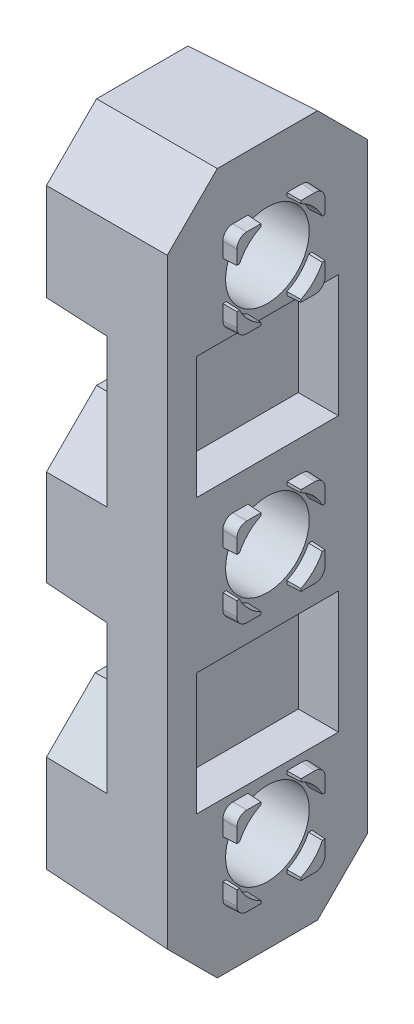
from build123d import *

# Parameters (mm, degrees)
SKETCH1_W                 = 9.716506228
SKETCH1_H                 = 35.116506228
BOSS_EXTRUDE1_DEPTH       = 6.35
CUT_EXTRUDE1_DEPTH        = 3.175
CUT_EXTRUDE2_DEPTH        = 3.175
CUT_EXTRUDE3_DEPTH        = 3.175
CUT_EXTRUDE4_DEPTH        = 3.175
BOSS_EXTRUDE2_DEPTH       = 0.6858
BOSS_EXTRUDE2_TAPER       = 2
BOSS_EXTRUDE3_DEPTH       = 0.6858
BOSS_EXTRUDE3_TAPER       = 2
BOSS_EXTRUDE4_DEPTH       = 0.6858
BOSS_EXTRUDE4_TAPER       = 2
BOSS_EXTRUDE5_DEPTH       = 0.6858
BOSS_EXTRUDE5_TAPER       = 2
BOSS_EXTRUDE6_DEPTH       = 0.6858
BOSS_EXTRUDE6_TAPER       = 2
BOSS_EXTRUDE7_DEPTH       = 0.6858
BOSS_EXTRUDE7_TAPER       = 2
BOSS_EXTRUDE8_DEPTH       = 0.6858
BOSS_EXTRUDE8_TAPER       = 2
BOSS_EXTRUDE9_DEPTH       = 0.6858
BOSS_EXTRUDE9_TAPER       = 2
BOSS_EXTRUDE10_DEPTH      = 0.6858
BOSS_EXTRUDE10_TAPER      = 2
BOSS_EXTRUDE11_DEPTH      = 0.6858
BOSS_EXTRUDE11_TAPER      = 2
BOSS_EXTRUDE12_DEPTH      = 0.6858
BOSS_EXTRUDE12_TAPER      = 2
BOSS_EXTRUDE13_DEPTH      = 0.6858
BOSS_EXTRUDE13_TAPER      = 2
SKETCH18_W                = 7.200000746
SKETCH18_H                = 6.200001039
CUT_EXTRUDE5_DEPTH        = 2.032
SKETCH19_W                = 7.200000746
SKETCH19_H                = 6.200000866
CUT_EXTRUDE6_DEPTH        = 2.032
DRAFT1_ANGLE              = 2.827279459
DRAFT2_ANGLE              = 2
F_6_CLEARANCE_HOLE1_D     = 4.2418
F_6_CLEARANCE_HOLE1_DEPTH = 7.0358
CHAMFER1_SIZE             = 2.536908263
CHAMFER1_PART_2_SIZE      = 2.536908263
FILLET1_R                 = 0.507999989


with BuildPart() as part:
    # Sketch1 → Boss-Extrude1 (new body)
    with BuildSketch(Plane(origin=(88.976200533, 0, 0), x_dir=(0, 0, -1), z_dir=(1, 0, 0))):
        with Locations((12.699999697, 26.416015382)):
            Rectangle(SKETCH1_W, SKETCH1_H)
    extrude(amount=-BOSS_EXTRUDE1_DEPTH)

    # Sketch2 → Cut-Extrude1 (cut)
    with BuildSketch(Plane.ZY.offset(-82.626200533)):
        Polygon((-7.841746583, 36.509270747), (-10.315251163, 34.035766168), (-11.699992639, 34.035766168), (-11.699992639, 31.385266496), (-10.380199322, 31.385266496), (-7.841746583, 28.846813757), align=None)
    extrude(amount=-CUT_EXTRUDE1_DEPTH, mode=Mode.SUBTRACT)

    # Sketch3 → Cut-Extrude2 (cut)
    with BuildSketch(Plane.ZY.offset(-82.626200533)):
        Polygon((-7.841746583, 23.985217007), (-10.380199322, 21.446764268), (-11.699997599, 21.446764268), (-11.699997599, 18.796264596), (-10.315251163, 18.796264596), (-7.841746583, 16.322760016), align=None)
    extrude(amount=-CUT_EXTRUDE2_DEPTH, mode=Mode.SUBTRACT)

    # Sketch4 → Cut-Extrude3 (cut)
    with BuildSketch(Plane.ZY.offset(-82.626200533)):
        Polygon((-17.558252811, 16.322760016), (-15.084748232, 18.796264596), (-13.699997366, 18.796264596), (-13.699997366, 21.446764268), (-15.019800072, 21.446764268), (-17.558252811, 23.985217007), align=None)
    extrude(amount=-CUT_EXTRUDE3_DEPTH, mode=Mode.SUBTRACT)

    # Sketch5 → Cut-Extrude4 (cut)
    with BuildSketch(Plane.ZY.offset(-82.626200533)):
        Polygon((-17.558252811, 28.846813757), (-15.019800072, 31.385266496), (-13.699992522, 31.385266496), (-13.699992522, 34.035766168), (-15.084748232, 34.035766168), (-17.558252811, 36.509270747), align=None)
    extrude(amount=-CUT_EXTRUDE4_DEPTH, mode=Mode.SUBTRACT)

    # Sketch6 → Boss-Extrude2 (add)
    with BuildSketch(Plane(origin=(88.976200533, 0, 0), x_dir=(0, 0, -1), z_dir=(1, 0, 0))):
        with BuildLine():
            ThreePointArc((11.709394811, 24.327642329), (11.065588197, 24.781603881), (10.611626644, 25.425410496))
            Line((10.611626644, 25.425410496), (10.439394811, 25.425410496))
            Line((10.439394811, 25.425410496), (10.439394811, 24.155410496))
            Line((10.439394811, 24.155410496), (11.709394811, 24.155410496))
            Line((11.709394811, 24.155410496), (11.709394811, 24.327642329))
        make_face()
    extrude(amount=BOSS_EXTRUDE2_DEPTH, taper=BOSS_EXTRUDE2_TAPER)

    # Sketch7 → Boss-Extrude3 (add)
    with BuildSketch(Plane(origin=(88.976200533, 0, 0), x_dir=(0, 0, -1), z_dir=(1, 0, 0))):
        with BuildLine():
            ThreePointArc((14.788362978, 25.425410496), (14.334401425, 24.781603881), (13.690594811, 24.327642329))
            Line((13.690594811, 24.327642329), (13.690594811, 24.155410496))
            Line((13.690594811, 24.155410496), (14.960594811, 24.155410496))
            Line((14.960594811, 24.155410496), (14.960594811, 25.425410496))
            Line((14.960594811, 25.425410496), (14.788362978, 25.425410496))
        make_face()
    extrude(amount=BOSS_EXTRUDE3_DEPTH, taper=BOSS_EXTRUDE3_TAPER)

    # Sketch8 → Boss-Extrude4 (add)
    with BuildSketch(Plane(origin=(88.976200533, 0, 0), x_dir=(0, 0, -1), z_dir=(1, 0, 0))):
        with BuildLine():
            ThreePointArc((13.690594811, 28.504378662), (14.334401425, 28.05041711), (14.788362978, 27.406610496))
            Line((14.788362978, 27.406610496), (14.960594811, 27.406610496))
            Line((14.960594811, 27.406610496), (14.960594811, 28.676610496))
            Line((14.960594811, 28.676610496), (13.690594811, 28.676610496))
            Line((13.690594811, 28.676610496), (13.690594811, 28.504378662))
        make_face()
    extrude(amount=BOSS_EXTRUDE4_DEPTH, taper=BOSS_EXTRUDE4_TAPER)

    # Sketch9 → Boss-Extrude5 (add)
    with BuildSketch(Plane(origin=(88.976200533, 0, 0), x_dir=(0, 0, -1), z_dir=(1, 0, 0))):
        with BuildLine():
            ThreePointArc((10.611626644, 27.406610496), (11.065588197, 28.05041711), (11.709394811, 28.504378662))
            Line((11.709394811, 28.504378662), (11.709394811, 28.676610496))
            Line((11.709394811, 28.676610496), (10.439394811, 28.676610496))
            Line((10.439394811, 28.676610496), (10.439394811, 27.406610496))
            Line((10.439394811, 27.406610496), (10.611626644, 27.406610496))
        make_face()
    extrude(amount=BOSS_EXTRUDE5_DEPTH, taper=BOSS_EXTRUDE5_TAPER)

    # Sketch10 → Boss-Extrude6 (add)
    with BuildSketch(Plane(origin=(88.976200533, 0, 0), x_dir=(0, 0, -1), z_dir=(1, 0, 0))):
        with BuildLine():
            ThreePointArc((11.709394811, 37.027642329), (11.065588197, 37.481603881), (10.611626644, 38.125410496))
            Line((10.611626644, 38.125410496), (10.439394811, 38.125410496))
            Line((10.439394811, 38.125410496), (10.439394811, 36.855410496))
            Line((10.439394811, 36.855410496), (11.709394811, 36.855410496))
            Line((11.709394811, 36.855410496), (11.709394811, 37.027642329))
        make_face()
    extrude(amount=BOSS_EXTRUDE6_DEPTH, taper=BOSS_EXTRUDE6_TAPER)

    # Sketch11 → Boss-Extrude7 (add)
    with BuildSketch(Plane(origin=(88.976200533, 0, 0), x_dir=(0, 0, -1), z_dir=(1, 0, 0))):
        with BuildLine():
            ThreePointArc((14.788362978, 38.125410496), (14.334401425, 37.481603881), (13.690594811, 37.027642329))
            Line((13.690594811, 37.027642329), (13.690594811, 36.855410496))
            Line((13.690594811, 36.855410496), (14.960594811, 36.855410496))
            Line((14.960594811, 36.855410496), (14.960594811, 38.125410496))
            Line((14.960594811, 38.125410496), (14.788362978, 38.125410496))
        make_face()
    extrude(amount=BOSS_EXTRUDE7_DEPTH, taper=BOSS_EXTRUDE7_TAPER)

    # Sketch12 → Boss-Extrude8 (add)
    with BuildSketch(Plane(origin=(88.976200533, 0, 0), x_dir=(0, 0, -1), z_dir=(1, 0, 0))):
        with BuildLine():
            ThreePointArc((13.690594811, 41.204378662), (14.334401425, 40.75041711), (14.788362978, 40.106610496))
            Line((14.788362978, 40.106610496), (14.960594811, 40.106610496))
            Line((14.960594811, 40.106610496), (14.960594811, 41.376610496))
            Line((14.960594811, 41.376610496), (13.690594811, 41.376610496))
            Line((13.690594811, 41.376610496), (13.690594811, 41.204378662))
        make_face()
    extrude(amount=BOSS_EXTRUDE8_DEPTH, taper=BOSS_EXTRUDE8_TAPER)

    # Sketch13 → Boss-Extrude9 (add)
    with BuildSketch(Plane(origin=(88.976200533, 0, 0), x_dir=(0, 0, -1), z_dir=(1, 0, 0))):
        with BuildLine():
            ThreePointArc((10.611626644, 40.106610496), (11.065588197, 40.75041711), (11.709394811, 41.204378662))
            Line((11.709394811, 41.204378662), (11.709394811, 41.376610496))
            Line((11.709394811, 41.376610496), (10.439394811, 41.376610496))
            Line((10.439394811, 41.376610496), (10.439394811, 40.106610496))
            Line((10.439394811, 40.106610496), (10.611626644, 40.106610496))
        make_face()
    extrude(amount=BOSS_EXTRUDE9_DEPTH, taper=BOSS_EXTRUDE9_TAPER)

    # Sketch14 → Boss-Extrude10 (add)
    with BuildSketch(Plane(origin=(88.976200533, 0, 0), x_dir=(0, 0, -1), z_dir=(1, 0, 0))):
        with BuildLine():
            ThreePointArc((11.709394811, 11.627642329), (11.065588197, 12.081603882), (10.611626644, 12.725410496))
            Line((10.611626644, 12.725410496), (10.439394811, 12.725410496))
            Line((10.439394811, 12.725410496), (10.439394811, 11.455410496))
            Line((10.439394811, 11.455410496), (11.709394811, 11.455410496))
            Line((11.709394811, 11.455410496), (11.709394811, 11.627642329))
        make_face()
    extrude(amount=BOSS_EXTRUDE10_DEPTH, taper=BOSS_EXTRUDE10_TAPER)

    # Sketch15 → Boss-Extrude11 (add)
    with BuildSketch(Plane(origin=(88.976200533, 0, 0), x_dir=(0, 0, -1), z_dir=(1, 0, 0))):
        with BuildLine():
            ThreePointArc((14.788362978, 12.725410496), (14.334401425, 12.081603882), (13.690594811, 11.627642329))
            Line((13.690594811, 11.627642329), (13.690594811, 11.455410496))
            Line((13.690594811, 11.455410496), (14.960594811, 11.455410496))
            Line((14.960594811, 11.455410496), (14.960594811, 12.725410496))
            Line((14.960594811, 12.725410496), (14.788362978, 12.725410496))
        make_face()
    extrude(amount=BOSS_EXTRUDE11_DEPTH, taper=BOSS_EXTRUDE11_TAPER)

    # Sketch16 → Boss-Extrude12 (add)
    with BuildSketch(Plane(origin=(88.976200533, 0, 0), x_dir=(0, 0, -1), z_dir=(1, 0, 0))):
        with BuildLine():
            ThreePointArc((13.690594811, 15.804378662), (14.334401425, 15.35041711), (14.788362978, 14.706610496))
            Line((14.788362978, 14.706610496), (14.960594811, 14.706610496))
            Line((14.960594811, 14.706610496), (14.960594811, 15.976610496))
            Line((14.960594811, 15.976610496), (13.690594811, 15.976610496))
            Line((13.690594811, 15.976610496), (13.690594811, 15.804378662))
        make_face()
    extrude(amount=BOSS_EXTRUDE12_DEPTH, taper=BOSS_EXTRUDE12_TAPER)

    # Sketch17 → Boss-Extrude13 (add)
    with BuildSketch(Plane(origin=(88.976200533, 0, 0), x_dir=(0, 0, -1), z_dir=(1, 0, 0))):
        with BuildLine():
            ThreePointArc((10.611626644, 14.706610496), (11.065588197, 15.35041711), (11.709394811, 15.804378662))
            Line((11.709394811, 15.804378662), (11.709394811, 15.976610496))
            Line((11.709394811, 15.976610496), (10.439394811, 15.976610496))
            Line((10.439394811, 15.976610496), (10.439394811, 14.706610496))
            Line((10.439394811, 14.706610496), (10.611626644, 14.706610496))
        make_face()
    extrude(amount=BOSS_EXTRUDE13_DEPTH, taper=BOSS_EXTRUDE13_TAPER)

    # Sketch18 → Cut-Extrude5 (cut)
    with BuildSketch(Plane(origin=(88.976200533, 0, 0), x_dir=(0, 0, -1), z_dir=(1, 0, 0))):
        with Locations((12.699998305, 19.46600963)):
            Rectangle(SKETCH18_W, SKETCH18_H)
    extrude(amount=-CUT_EXTRUDE5_DEPTH, mode=Mode.SUBTRACT)

    # Sketch19 → Cut-Extrude6 (cut)
    with BuildSketch(Plane(origin=(88.976200533, 0, 0), x_dir=(0, 0, -1), z_dir=(1, 0, 0))):
        with Locations((12.699992957, 33.366009543)):
            Rectangle(SKETCH19_W, SKETCH19_H)
    extrude(amount=-CUT_EXTRUDE6_DEPTH, mode=Mode.SUBTRACT)

    # Draft1
    draft1_faces = [part.faces().sort_by_distance(p)[0] for p in [
        (84.213700533, 30.116040126, -9.110972953),
        (84.213700533, 22.715990637, -9.110972953),
        (84.213700533, 22.715990637, -16.289026442),
        (84.213700533, 30.116040126, -16.289026442),
    ]]
    draft(draft1_faces, Plane(origin=(82.626200533, 0, 0), x_dir=(0, 0, -1), z_dir=(-1, 0, 0)), DRAFT1_ANGLE)

    # Draft2
    draft2_faces = [part.faces().sort_by_distance(p)[0] for p in [
        (85.801200533, 43.974268496, -12.699999697),
        (84.213700533, 35.272518458, -9.078498873),
        (84.213700533, 34.035766168, -11.007621901),
        (84.254709755, 31.385266496, -10.983227185),
        (84.254709612, 21.446764268, -10.98322967),
        (84.213700533, 18.796264596, -11.007624381),
        (84.213700533, 17.559512306, -9.078498873),
        (86.238234569, 26.416015382, -7.841746583),
        (85.801200533, 8.857762268, -12.699999697),
        (84.213700533, 17.559512306, -16.321500521),
        (84.213700533, 18.796264596, -14.392372799),
        (84.254709485, 21.446764268, -14.416767505),
        (84.254709347, 31.385266496, -14.416765078),
        (84.213700533, 34.035766168, -14.392370377),
        (84.213700533, 35.272518458, -16.321500521),
        (86.238234569, 26.416015382, -17.558252811),
    ]]
    draft(draft2_faces, Plane(origin=(82.626200533, 0, 0), x_dir=(0, 0, -1), z_dir=(-1, 0, 0)), DRAFT2_ANGLE)

    # #6 Clearance Hole1
    with Locations(Plane.ZY.offset(-82.626200533)):
        with Locations((-12.699994811, 26.416010496), (-12.699999697, 13.716015382), (-12.699999697, 39.116015382)):
            Hole(F_6_CLEARANCE_HOLE1_D / 2, depth=F_6_CLEARANCE_HOLE1_DEPTH)

    # Chamfer1
    chamfer1_edges = [part.edges().sort_by_distance(p)[0] for p in [
        (85.801200533, 8.746888825, -17.669126254),
        (85.801200533, 8.746888825, -7.73087314),
    ]]
    chamfer(chamfer1_edges, length=CHAMFER1_SIZE)

    # Chamfer1 part 2
    chamfer1_part_2_edges = [part.edges().sort_by_distance(p)[0] for p in [
        (85.801200533, 44.085141939, -17.669126254),
        (85.801200533, 44.085141939, -7.73087314),
    ]]
    chamfer(chamfer1_part_2_edges, length=CHAMFER1_PART_2_SIZE)

    # Fillet1
    fillet1_edges = [part.edges().sort_by_distance(p)[0] for p in [
        (89.319100533, 41.364636164, -10.451369143),
        (89.319100533, 15.964636164, -10.451369143),
        (89.319100533, 11.467384827, -14.948620479),
        (89.319100533, 24.167384827, -10.451369143),
        (89.319100533, 41.364636164, -14.948620479),
        (89.319100533, 24.167384827, -14.948620479),
        (89.319100533, 11.467384827, -10.451369143),
        (89.319100533, 28.664636164, -14.948620479),
        (89.319100533, 15.964636164, -14.948620479),
        (89.319100533, 36.867384827, -10.451369143),
        (89.319100533, 36.867384827, -14.948620479),
        (89.319100533, 28.664636164, -10.451369143),
    ]]
    fillet(fillet1_edges, radius=FILLET1_R)


solid = part.part
